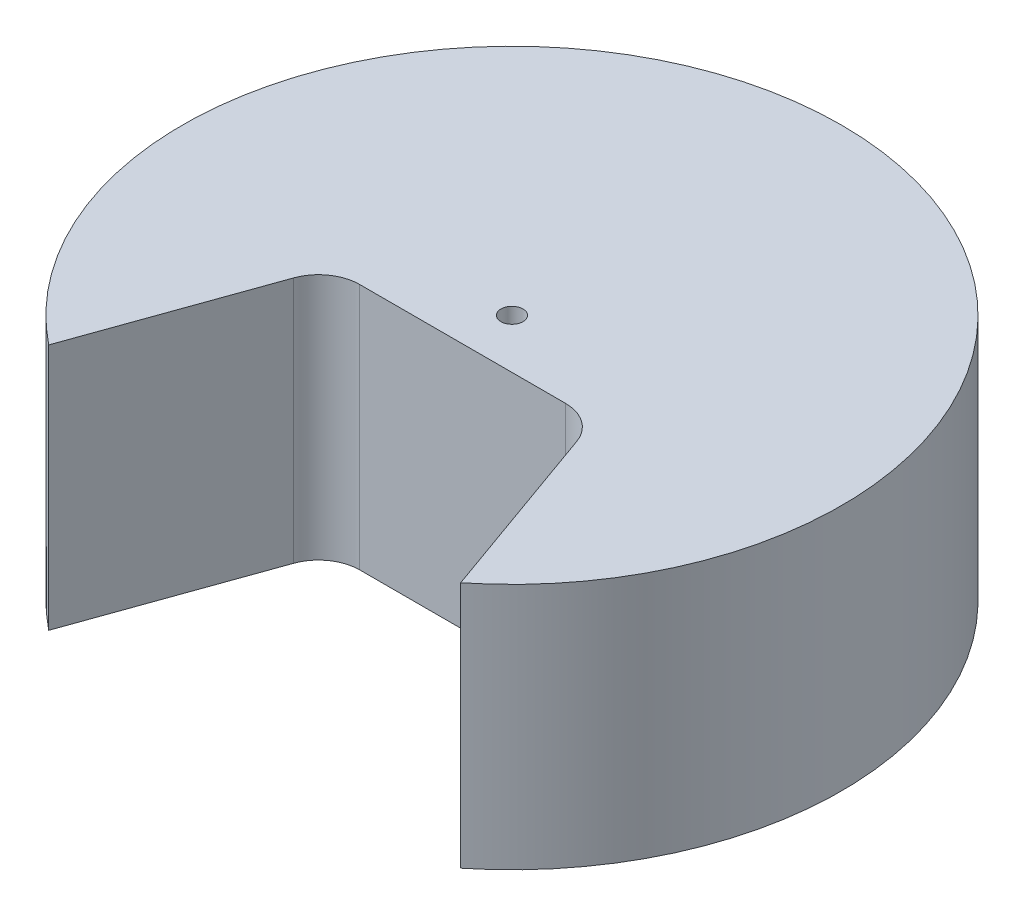
from build123d import *

# Parameters (mm, degrees)
SKETCH1_R            = 50.8
BOSS_EXTRUDE1_DEPTH  = 38.1
CUT_EXTRUDE1_REACH   = 83.32
FILLET1_R            = 6.35
M3_CLEARANCE_HOLE1_D = 3.4


with BuildPart() as part:
    # Sketch1 → Boss-Extrude1 (new body)
    with BuildSketch(Plane(origin=(0, 0, 0), x_dir=(1, 0, 0), z_dir=(0, 1, 0))):
        Circle(SKETCH1_R)
    extrude(amount=BOSS_EXTRUDE1_DEPTH)

    # Sketch2 → Cut-Extrude1 (cut, up to next)
    with BuildSketch(Plane(origin=(0, 38.1, 0), x_dir=(1, 0, 0), z_dir=(0, 1, 0)), mode=Mode.PRIVATE) as cut_extrude1_sk1:
        Polygon((31.75, -39.65573729), (20.32, -7.62), (-20.32, -7.62), (-31.75, -39.65573729), (-31.75, -50.8), (31.75, -50.8), align=None)
    cut_extrude1_tool1 = extrude(cut_extrude1_sk1.sketch, amount=-CUT_EXTRUDE1_REACH, mode=Mode.PRIVATE) & part.part
    add(cut_extrude1_tool1.solids().sort_by_distance((0, 38.1, 30.891742))[0], mode=Mode.SUBTRACT)

    # Fillet1
    fillet1_edges = [part.edges().sort_by_distance(p)[0] for p in [
        (20.32, 19.05, 7.62),
        (-20.32, 19.05, 7.62),
    ]]
    fillet(fillet1_edges, radius=FILLET1_R)

    # M3 Clearance Hole1 (through all)
    with Locations(Plane(origin=(0, 38.1, 0), x_dir=(1, 0, 0), z_dir=(0, 1, 0))):
        with Locations((0, 0)):
            Hole(M3_CLEARANCE_HOLE1_D / 2)


solid = part.part
